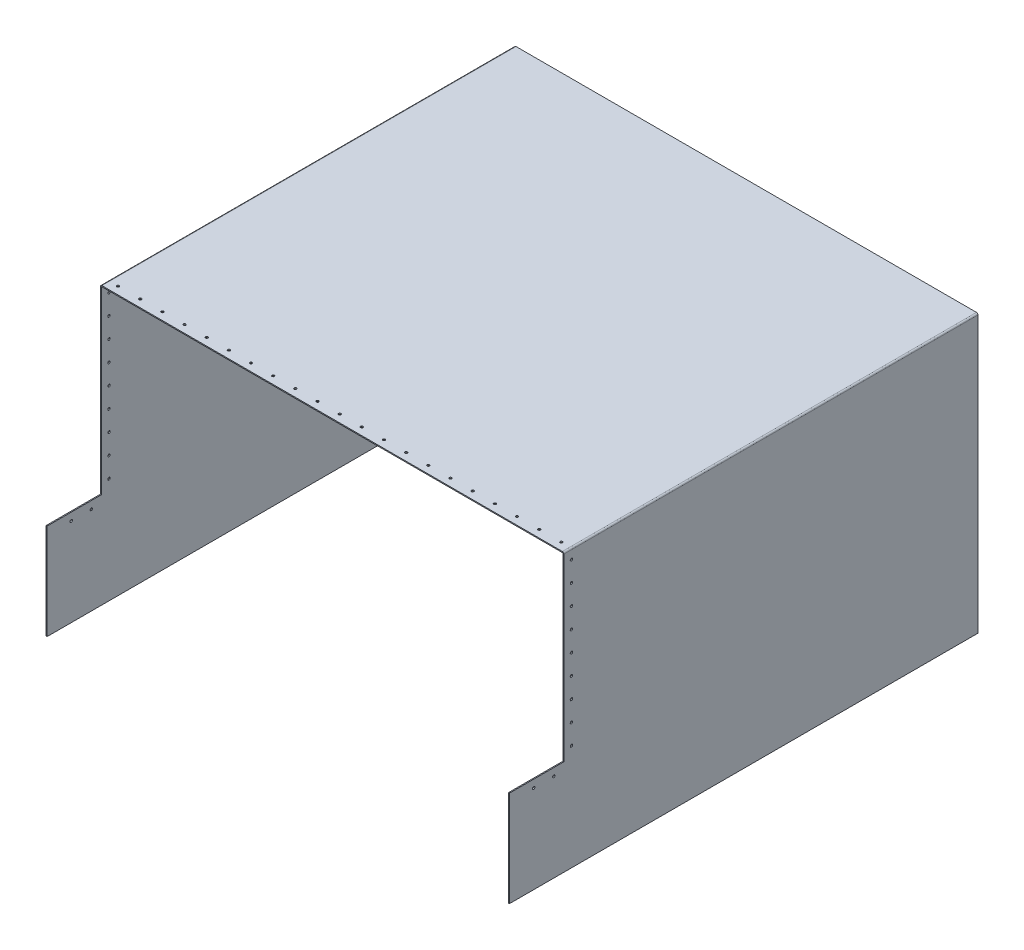
from build123d import *

# Parameters (mm, degrees)
SM_BASE_FLANGE_1_DEPTH = 465
SKETCH_4_W             = 54
SKETCH_4_H             = 180
CUT_EXTRUDE_2_DEPTH    = 710.542105868
HOLE_WIZARD_M21_D      = 2.4
HOLE_WIZARD_M21_DEPTH  = 5
HOLE_WIZARD_M21_TIP    = 0.721032743
HOLE_WIZARD_M22_D      = 2.4


# Sheet-metal steps are written as plain solids
with BuildPart() as part:
    # Sketch 1 → Базовая кромка1 (new body)
    with BuildSketch(Plane.XY):
        with BuildLine():
            Line((0, 0), (0, 273.5))
            ThreePointArc((0, 273.5), (0.146446609, 273.853553391), (0.5, 274))
            Line((0.5, 274), (457.5, 274))
            ThreePointArc((457.5, 274), (457.853553391, 273.853553391), (458, 273.5))
            Line((458, 273.5), (458, 0))
            Line((458, 0), (459, 0))
            Line((459, 0), (459, 273.5))
            ThreePointArc((459, 273.5), (458.560660172, 274.560660172), (457.5, 275))
            Line((457.5, 275), (0.5, 275))
            ThreePointArc((0.5, 275), (-0.560660172, 274.560660172), (-1, 273.5))
            Line((-1, 273.5), (-1, 0))
            Line((-1, 0), (0, 0))
        make_face()
    extrude(amount=SM_BASE_FLANGE_1_DEPTH)

    # Эскиз4 → Вырез-Вытянуть2 (cut, through all)
    with BuildSketch(Plane.ZY.offset(1)):
        with Locations((438, 185)):
            Rectangle(SKETCH_4_W, SKETCH_4_H)
    extrude(amount=-CUT_EXTRUDE_2_DEPTH, mode=Mode.SUBTRACT)

    # Отверстие с зазором M21
    with Locations(Plane(origin=(0, 275, 0), x_dir=(-1, 0, 0), z_dir=(0, 1, 0))):
        with Locations((-9, 403.5), (-31, 403.5), (-53, 403.5), (-75, 403.5), (-97, 403.5), (-119, 403.5), (-141, 403.5), (-163, 403.5), (-185, 403.5), (-207, 403.5), (-229, 403.5), (-251, 403.5), (-273, 403.5), (-295, 403.5), (-317, 403.5), (-339, 403.5), (-361, 403.5), (-383, 403.5), (-405, 403.5), (-427, 403.5), (-449, 403.5)):
            Hole(HOLE_WIZARD_M21_D / 2, depth=HOLE_WIZARD_M21_DEPTH)
            with Locations((0, 0, -(HOLE_WIZARD_M21_DEPTH + HOLE_WIZARD_M21_TIP / 2))):  # 118° drill point
                Cone(0, HOLE_WIZARD_M21_D / 2, HOLE_WIZARD_M21_TIP, mode=Mode.SUBTRACT)

    # Отверстие с зазором M22 (through all)
    with Locations(Plane(origin=(459, 0, 0), x_dir=(0, 0, -1), z_dir=(1, 0, 0))):
        with Locations((-403.5, 265), (-403.5, 245), (-403.5, 225), (-403.5, 205), (-403.5, 185), (-403.5, 165), (-403.5, 145), (-403.5, 125), (-403.5, 105), (-421, 87.5), (-441, 87.5)):
            Hole(HOLE_WIZARD_M22_D / 2)


solid = part.part
